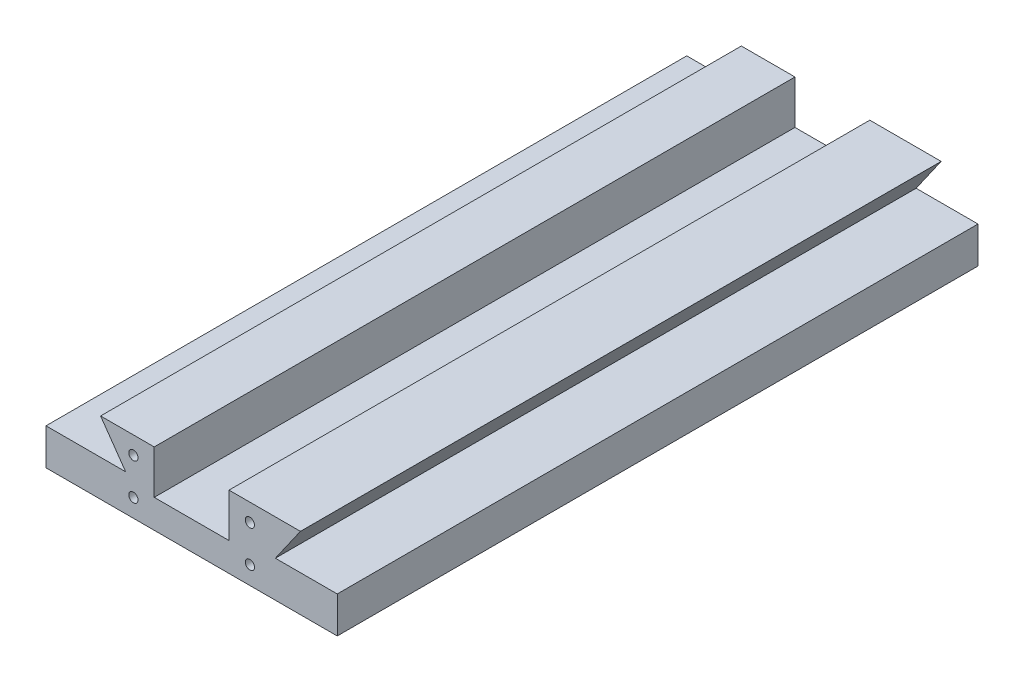
from build123d import *

# Parameters (mm, degrees)
X_GUIDE_EXTRUDE_DEPTH   = 279.4
END_PLATE_HOLES_D       = 4.0386
END_PLATE_HOLES_DEPTH   = 11.938
END_PLATE_HOLES_TIP     = 1.213317848
END_PLATE_HOLES_2_D     = 4.0386
END_PLATE_HOLES_2_DEPTH = 11.938
END_PLATE_HOLES_2_TIP   = 1.213317848


with BuildPart() as part:
    # dovetail-male-profile → x-guide-extrude (new body)
    with BuildSketch(Plane.XY):
        Polygon((36.509205331, 15.875), (47.447147285, 31.496), (16.310336319, 31.496), (16.310336319, 12.446), (-16.310336319, 12.446), (-16.310336319, 31.496), (-39.695228647, 31.496), (-28.757286692, 15.875), (-36.509205331, 15.875), (-63.5, 15.875), (-63.5, 0), (63.5, 0), (63.5, 15.875), align=None)
    extrude(amount=X_GUIDE_EXTRUDE_DEPTH)

    # end plate holes
    with Locations(Plane(origin=(0, 0, 0), x_dir=(-1, 0, 0), z_dir=(0, 0, -1))):
        with Locations((-25.4, 23.8125), (25.4, 23.8125), (25.4, 7.874), (-25.4, 7.874)):
            Hole(END_PLATE_HOLES_D / 2, depth=END_PLATE_HOLES_DEPTH)
            with Locations((0, 0, -(END_PLATE_HOLES_DEPTH + END_PLATE_HOLES_TIP / 2))):  # 118° drill point
                Cone(0, END_PLATE_HOLES_D / 2, END_PLATE_HOLES_TIP, mode=Mode.SUBTRACT)

    # end plate holes 2
    with Locations(Plane.XY.offset(279.4)):
        with Locations((25.4, 23.8125), (25.4, 7.874), (-25.4, 7.874), (-25.4, 23.8125)):
            Hole(END_PLATE_HOLES_2_D / 2, depth=END_PLATE_HOLES_2_DEPTH)
            with Locations((0, 0, -(END_PLATE_HOLES_2_DEPTH + END_PLATE_HOLES_2_TIP / 2))):  # 118° drill point
                Cone(0, END_PLATE_HOLES_2_D / 2, END_PLATE_HOLES_2_TIP, mode=Mode.SUBTRACT)


solid = part.part
